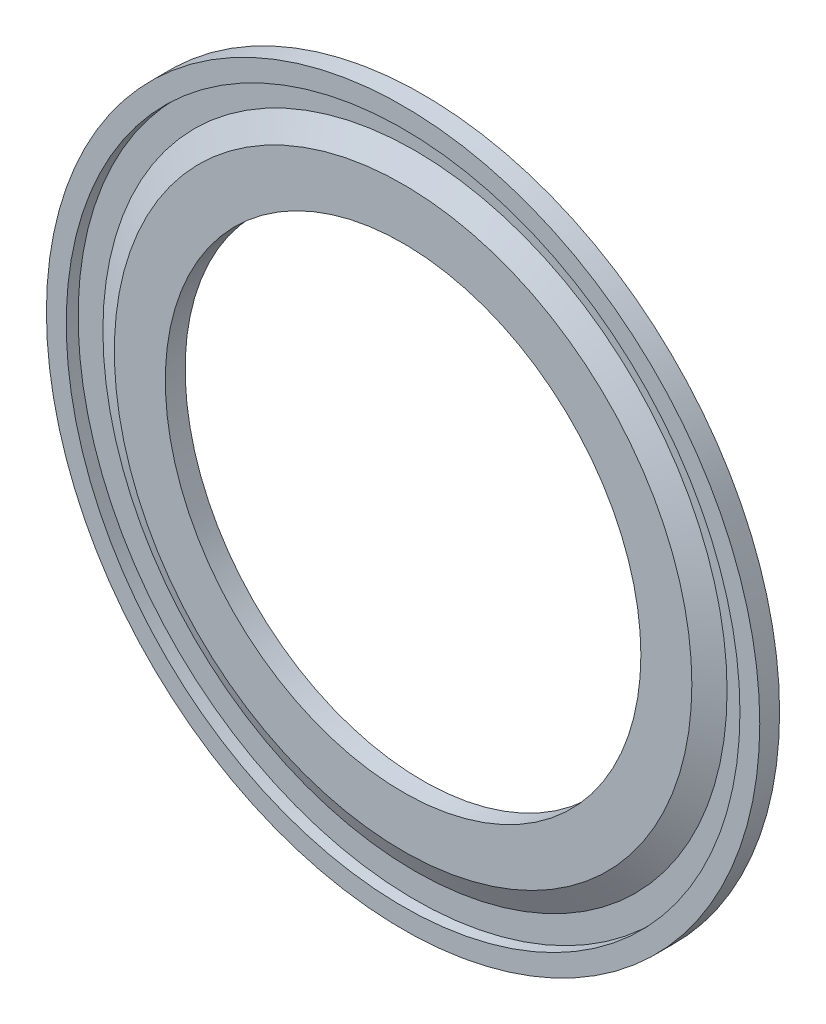
from build123d import *


with BuildPart() as part:
    # Esquisse1 → Révolution1 (revolve)
    with BuildSketch(Plane(origin=(0, 0, 0), x_dir=(0, 0, -1), z_dir=(1, 0, 0))):
        Polygon((-0.5, 17), (0.1, 17), (0.1, 15.75), (-0.5, 14.572433697), (-0.5, 12), (0.5, 12), (0.5, 18), (-0.5, 18), align=None)
    revolve(axis=Axis((0, 0, 0), (0, 0, -1)))


solid = part.part
